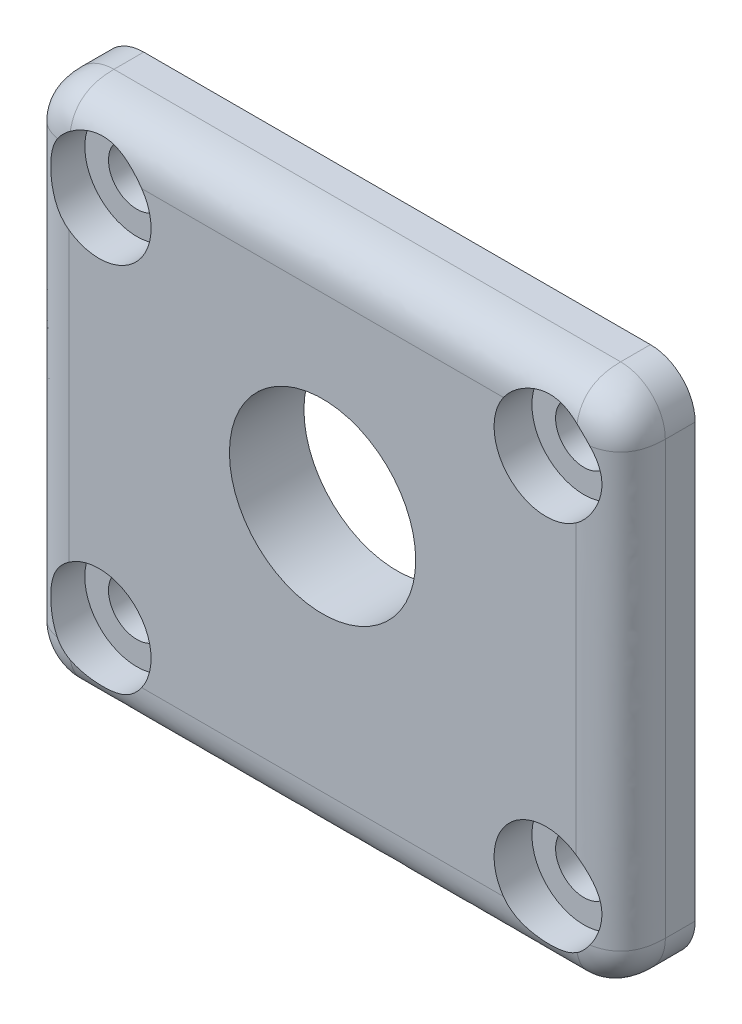
from build123d import *

# Parameters (mm, degrees)
SKETCH1_W           = 40
SKETCH1_H           = 35
BOSS_EXTRUDE1_DEPTH = 5
SKETCH2_R           = 1.905
CUT_EXTRUDE1_DEPTH  = 28.041634566
FILLET1_R           = 3
SKETCH3_R           = 3.4925
CUT_EXTRUDE2_DEPTH  = 2.54
FILLET2_SIZE        = 3
BOSS_EXTRUDE2_DEPTH = 2.5
SKETCH6_W           = 26.5
SKETCH6_H           = 2
CUT_EXTRUDE4_DEPTH  = 2.5
CUT_EXTRUDE3_REACH  = 29.613
SKETCH7_R           = 6.25
BOSS_EXTRUDE4_DEPTH = 2.5


with BuildPart() as part:
    # Sketch1 → Boss-Extrude1 (new body)
    with BuildSketch(Plane.XY):
        Rectangle(SKETCH1_W, SKETCH1_H)
    extrude(amount=BOSS_EXTRUDE1_DEPTH)

    # Sketch2 → Cut-Extrude1 (cut, through all)
    with BuildSketch(Plane.XY.offset(5)):
        with Locations((-15, 12.5)):
            Circle(SKETCH2_R)
        with Locations(Location((15, 12.5, 0), (0, 0, 180))):
            Circle(SKETCH2_R)
        with Locations((15, -12.5)):
            Circle(SKETCH2_R)
        with Locations(Location((-15, -12.5, 0), (0, 0, 180))):
            Circle(SKETCH2_R)
    extrude(amount=-CUT_EXTRUDE1_DEPTH, mode=Mode.SUBTRACT)

    # Fillet1
    fillet1_edges = [part.edges().sort_by_distance(p)[0] for p in [
        (20, -17.5, 2.5),
        (-20, -17.5, 2.5),
        (-20, 17.5, 2.5),
        (20, 17.5, 2.5),
    ]]
    fillet(fillet1_edges, radius=FILLET1_R)

    # Sketch3 → Cut-Extrude2 (cut)
    with BuildSketch(Plane.XY.offset(5)):
        with Locations((-15, 12.5)):
            Circle(SKETCH3_R)
        with Locations(Location((15, 12.5, 0), (0, 0, 180))):
            Circle(SKETCH3_R)
        with Locations((15, -12.5)):
            Circle(SKETCH3_R)
        with Locations(Location((-15, -12.5, 0), (0, 0, 180))):
            Circle(SKETCH3_R)
    extrude(amount=-CUT_EXTRUDE2_DEPTH, mode=Mode.SUBTRACT)

    # Fillet2
    # a fillet whose section is not a circle: 3 mm, written as the material it takes off along each edge
    with BuildSketch(Plane(origin=(20, 14.5, 5), x_dir=(-1, 0, 0), z_dir=(0, -1, 0)), Plane(origin=(-20, -14.5, 5), x_dir=(1, 0, 0), z_dir=(0, 1, 0))) as fillet2_piece_1:
        with BuildLine():
            Bezier((FILLET2_SIZE, 0), (0, 0), (0, FILLET2_SIZE), weights=[1, 1, 1])
            Line((0, FILLET2_SIZE), (0, 0))
            Line((0, 0), (FILLET2_SIZE, 0))
        make_face()
    extrude(amount=29, mode=Mode.SUBTRACT)
    with BuildSketch(Plane(origin=(-17, 17.5, 5), x_dir=(0, 0, -1), z_dir=(1, 0, 0))) as fillet2_piece_2:
        with BuildLine():
            Bezier((FILLET2_SIZE, 0), (0, 0), (0, -FILLET2_SIZE), weights=[1, 1, 1])
            Line((0, -FILLET2_SIZE), (0, 0))
            Line((0, 0), (FILLET2_SIZE, 0))
        make_face()
    extrude(amount=34, mode=Mode.SUBTRACT)
    with BuildSketch(Plane(origin=(17, -17.5, 5), x_dir=(0, 1, 0), z_dir=(-1, 0, 0))) as fillet2_piece_3:
        with BuildLine():
            Bezier((FILLET2_SIZE, 0), (0, 0), (0, FILLET2_SIZE), weights=[1, 1, 1])
            Line((0, FILLET2_SIZE), (0, 0))
            Line((0, 0), (FILLET2_SIZE, 0))
        make_face()
    extrude(amount=34, mode=Mode.SUBTRACT)
    with BuildSketch(Plane(origin=(-17, -14.5, 5), x_dir=(-1, 0, 0), z_dir=(0, 1, 0))) as fillet2_piece_4:
        with BuildLine():
            Bezier((3 - FILLET2_SIZE, 0), (3, 0), (3, -FILLET2_SIZE), weights=[1, 1, 1])
            Line((3, -FILLET2_SIZE), (3, 0))
            Line((3, 0), (3 - FILLET2_SIZE, 0))
        make_face()
    revolve(axis=Axis((-17, -14.5, 5), (0, 0, 1)), revolution_arc=90, mode=Mode.SUBTRACT)
    with BuildSketch(Plane(origin=(-17, 14.5, 5), x_dir=(0, 1, 0), z_dir=(1, 0, 0))) as fillet2_piece_5:
        with BuildLine():
            Bezier((3, -FILLET2_SIZE), (3, 0), (3 - FILLET2_SIZE, 0), weights=[1, 1, 1])
            Line((3 - FILLET2_SIZE, 0), (3, 0))
            Line((3, 0), (3, -FILLET2_SIZE))
        make_face()
    revolve(axis=Axis((-17, 14.5, 5), (0, 0, 1)), revolution_arc=90, mode=Mode.SUBTRACT)
    with BuildSketch(Plane(origin=(17, -14.5, 5), x_dir=(1, 0, 0), z_dir=(0, 1, 0))) as fillet2_piece_6:
        with BuildLine():
            Bezier((3 - FILLET2_SIZE, 0), (3, 0), (3, FILLET2_SIZE), weights=[1, 1, 1])
            Line((3, FILLET2_SIZE), (3, 0))
            Line((3, 0), (3 - FILLET2_SIZE, 0))
        make_face()
    revolve(axis=Axis((17, -14.5, 5), (0, 0, -1)), revolution_arc=90, mode=Mode.SUBTRACT)
    with BuildSketch(Plane(origin=(17, 14.5, 5), x_dir=(0, 1, 0), z_dir=(-1, 0, 0))) as fillet2_piece_7:
        with BuildLine():
            Bezier((3, FILLET2_SIZE), (3, 0), (3 - FILLET2_SIZE, 0), weights=[1, 1, 1])
            Line((3 - FILLET2_SIZE, 0), (3, 0))
            Line((3, 0), (3, FILLET2_SIZE))
        make_face()
    revolve(axis=Axis((17, 14.5, 5), (0, 0, -1)), revolution_arc=90, mode=Mode.SUBTRACT)

    # Sketch5 → Boss-Extrude2 (add)
    with BuildSketch(Plane(origin=(0, 0, 0), x_dir=(-1, 0, 0), z_dir=(0, 0, -1))):
        with BuildLine():
            Line((-10.5, 12), (10.5, 12))
            ThreePointArc((10.5, 12), (11.671572875, 9.171572875), (14.5, 8))
            Line((14.5, 8), (14.5, -8))
            ThreePointArc((14.5, -8), (11.671572875, -9.171572875), (10.5, -12))
            Line((10.5, -12), (-10.5, -12))
            ThreePointArc((-10.5, -12), (-11.671572875, -9.171572875), (-14.5, -8))
            Line((-14.5, -8), (-14.5, 8))
            ThreePointArc((-14.5, 8), (-11.671572875, 9.171572875), (-10.5, 12))
        make_face()
        with BuildLine():
            Line((-9.601020514, -11), (9.601020514, -11))
            ThreePointArc((9.601020514, -11), (10.964466094, -8.464466094), (13.5, -7.101020514))
            Line((13.5, -7.101020514), (13.5, 7.101020514))
            ThreePointArc((13.5, 7.101020514), (10.964466094, 8.464466094), (9.601020514, 11))
            Line((9.601020514, 11), (-9.601020514, 11))
            ThreePointArc((-9.601020514, 11), (-10.964466094, 8.464466094), (-13.5, 7.101020514))
            Line((-13.5, 7.101020514), (-13.5, -7.101020514))
            ThreePointArc((-13.5, -7.101020514), (-10.964466094, -8.464466094), (-9.601020514, -11))
        make_face(mode=Mode.SUBTRACT)
    extrude(amount=BOSS_EXTRUDE2_DEPTH)

    # Sketch6 → Cut-Extrude4 (cut)
    with BuildSketch(Plane(origin=(0, 0, 0), x_dir=(-1, 0, 0), z_dir=(0, 0, -1))):
        with Locations((0, -7)):
            Rectangle(SKETCH6_W, SKETCH6_H)
    extrude(amount=CUT_EXTRUDE4_DEPTH, mode=Mode.SUBTRACT)

    # Sketch7 → Cut-Extrude3 (cut, up to next)
    with BuildSketch(Plane.XY.offset(5), mode=Mode.PRIVATE) as cut_extrude3_sk1:
        with Locations((0, 2.1)):
            Circle(SKETCH7_R)
    cut_extrude3_tool1 = extrude(cut_extrude3_sk1.sketch, amount=-CUT_EXTRUDE3_REACH, mode=Mode.PRIVATE) & part.part
    add(cut_extrude3_tool1.solids().sort_by_distance((0, 2.1, 5))[0], mode=Mode.SUBTRACT)

    # Sketch8 → Boss-Extrude4 (add)
    with BuildSketch(Plane(origin=(0, 0, 0), x_dir=(-1, 0, 0), z_dir=(0, 0, -1))):
        with BuildLine():
            Line((-14.5, -8), (14.5, -8))
            ThreePointArc((14.5, -8), (11.671572875, -9.171572875), (10.5, -12))
            Line((10.5, -12), (-10.5, -12))
            ThreePointArc((-10.5, -12), (-11.671572875, -9.171572875), (-14.5, -8))
        make_face()
    extrude(amount=BOSS_EXTRUDE4_DEPTH)


solid = part.part
